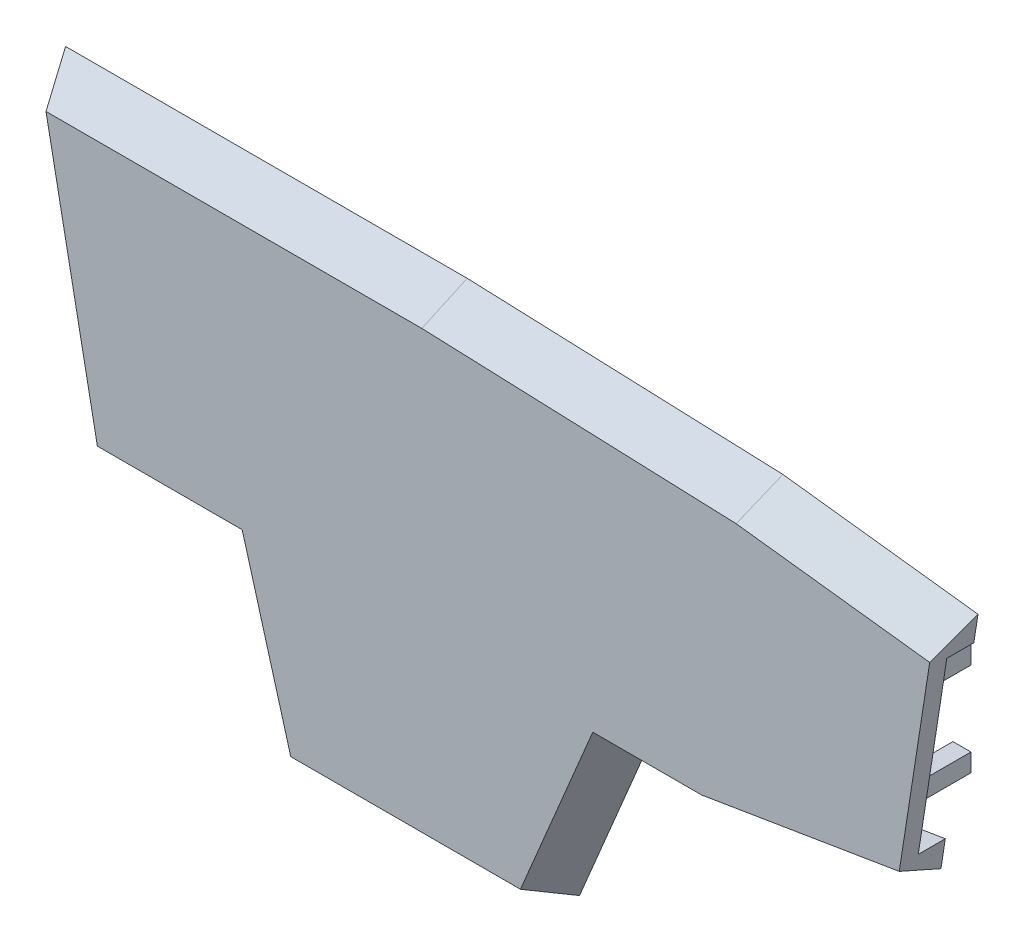
from build123d import *

# Parameters (mm, degrees)
BOSS_EXTRUDE1_DEPTH = 5
SHELL1_DEPTH        = 3
DRAFT1_ANGLE        = -25
CUT_EXTRUDE4_DEPTH  = 3
SKETCH7_W           = 2
SKETCH7_H           = 2
BOSS_EXTRUDE3_DEPTH = 6.167458
SKETCH9_W           = 2
SKETCH9_H           = 3
CUT_EXTRUDE5_DEPTH  = 1


# Read off the part's stored shape, not the designer's step: Shell1
with BuildPart() as part:
    # Sketch1 → Boss-Extrude1 (new body)
    with BuildSketch(Plane.XY):
        Polygon((-25.983626021, 33.041313611), (-21.875122617, 59.537949952), (-43.516730546, 62.148416278), (-78.528153024, 63.480237824), (-123.086733491, 63.480237824), (-116.479692334, 29.513255832), (-100.259099485, 29.513255832), (-94.872589048, 10.409344773), (-66.079679944, 10.409344773), (-58.05527459, 29.513255832), (-47.335578993, 29.513255832), align=None)
    extrude(amount=BOSS_EXTRUDE1_DEPTH)

    # Shell1 outline → Shell1 (cut)
    with BuildSketch(Plane.XY):
        Polygon((-47.581760232, 32.513255832), (-27.576866011, 35.818734388), (-24.321805769, 56.811329265), (-43.753778982, 59.155263778), (-78.585191842, 60.480237824), (-119.446966155, 60.480237824), (-114.007006811, 32.513255832), (-97.988004481, 32.513255832), (-92.601494043, 13.409344773), (-68.0734658, 13.409344773), (-60.049060446, 32.513255832), align=None)
    extrude(amount=SHELL1_DEPTH, mode=Mode.SUBTRACT)

    # Draft1
    draft1_faces = [part.faces().sort_by_distance(p)[0] for p in [
        (-52.695426792, 29.513255832, 2.5),
        (-36.659602507, 31.277284722, 2.5),
        (-62.067477267, 19.961300303, 2.5),
        (-80.476134496, 10.409344773, 2.5),
        (-97.565844267, 19.961300303, 2.5),
        (-108.36939591, 29.513255832, 2.5),
        (-119.783212913, 46.496746828, 2.5),
        (-32.695926582, 60.843183115, 2.5),
        (-61.022441785, 62.814327051, 2.5),
        (-100.807443258, 63.480237824, 2.5),
    ]]
    draft(draft1_faces, Plane(origin=(0, 0, 0), x_dir=(-1, 0, 0), z_dir=(0, 0, -1)), DRAFT1_ANGLE)

    # Sketch6 → Cut-Extrude4 (cut)
    with BuildSketch(Plane(origin=(0, 0, 0), x_dir=(-1, 0, 0), z_dir=(0, 0, -1))):
        Polygon((24.321805769, 56.811329265), (22.335064622, 56.571683446), (25.499748774, 36.161943725), (27.576866011, 35.818734388), align=None)
    extrude(amount=-CUT_EXTRUDE4_DEPTH, mode=Mode.SUBTRACT)

    # Sketch7 → Boss-Extrude3 (add)
    with BuildSketch(Plane(origin=(0, 0, 3), x_dir=(-1, 0, 0), z_dir=(0, 0, -1))):
        with Locations((26.823354353, 52.098786124)):
            Rectangle(SKETCH7_W, SKETCH7_H)
        with Locations((26.823354353, 41.748786124)):
            Rectangle(SKETCH7_W, SKETCH7_H)
    extrude(amount=BOSS_EXTRUDE3_DEPTH)

    # Sketch9 → Cut-Extrude5 (cut)
    with BuildSketch(Plane(origin=(0, 0, 3), x_dir=(-1, 0, 0), z_dir=(0, 0, -1))):
        with Locations((80.337479922, 14.909344773)):
            Rectangle(SKETCH9_W, SKETCH9_H)
        with Locations((53.815410339, 34.013255832)):
            Rectangle(SKETCH9_W, SKETCH9_H)
        Polygon((116.917921585, 47.47834949), (113.973113599, 48.051154798), (113.591243393, 46.087949474), (116.53605138, 45.515144166), align=None)
    extrude(amount=-CUT_EXTRUDE5_DEPTH, mode=Mode.SUBTRACT)


solid = part.part
